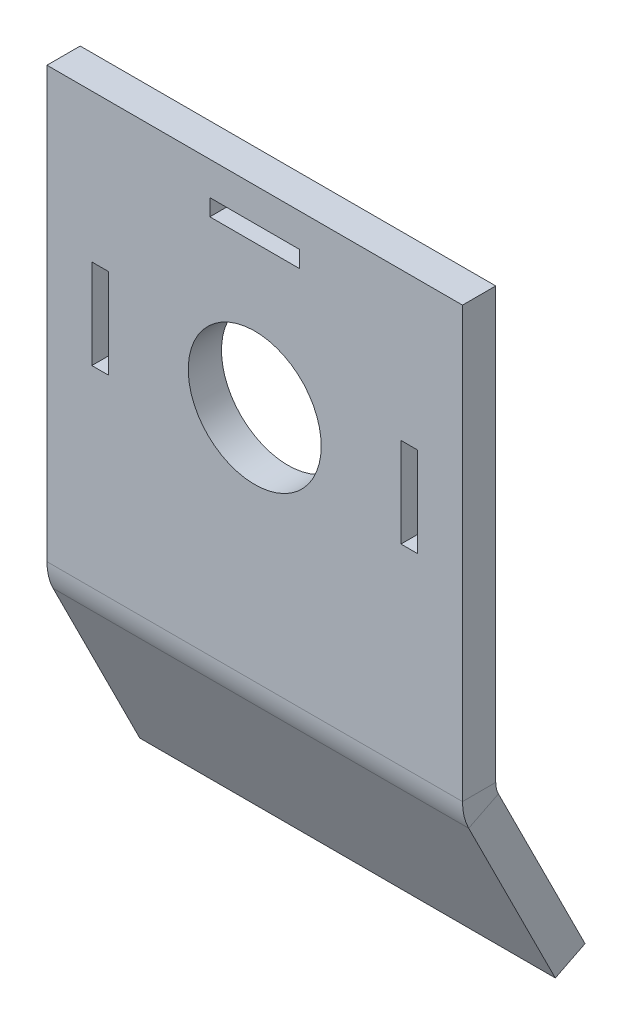
from build123d import *

# Parameters (mm, degrees)
BASES_W              = 12.5
BASES_H              = 13.35
BASE_DEPTH           = 1
SCREWACCESSS_R       = 2
SCREW_ACCESS_DEPTH   = 10.198811064
NEUTRALS_W           = 0.5
NEUTRALS_H           = 2.7
NEUTRAL_DEPTH        = 1.6
GROUNDS_W            = 2.7
GROUNDS_H            = 0.5
GROUND_DEPTH         = 1.6
EDGE_FLANGE1_START   = -6.25
EDGE_FLANGE1_DEPTH   = 12.5
EDGE_FLANGE1_2_DEPTH = 12.5


# Read off the part's stored shape, not the designer's step: Edge-Flange1
with BuildPart() as part:
    # BaseS → BASE (new body)
    with BuildSketch(Plane.XY):
        Rectangle(BASES_W, BASES_H)
    extrude(amount=-BASE_DEPTH)

    # ScrewAccessS → SCREW ACCESS (cut, through all)
    with BuildSketch(Plane.XY):
        with Locations((0, 0.875)):
            Circle(SCREWACCESSS_R)
    extrude(amount=-SCREW_ACCESS_DEPTH, mode=Mode.SUBTRACT)

    # NeutralS → NEUTRAL (cut)
    with BuildSketch(Plane.XY):
        with Locations((4.65, 0.875)):
            Rectangle(NEUTRALS_W, NEUTRALS_H)
    neutral = extrude(amount=-NEUTRAL_DEPTH, mode=Mode.SUBTRACT)

    # LINE HM: NEUTRAL across plane
    add(neutral.mirror(Plane(origin=(0, 0, 0), x_dir=(0, 0, 1), z_dir=(1, 0, 0))), mode=Mode.SUBTRACT)

    # GroundS → GROUND (cut)
    with BuildSketch(Plane.XY):
        with Locations((0, 5.425)):
            Rectangle(GROUNDS_W, GROUNDS_H)
    extrude(amount=-GROUND_DEPTH, mode=Mode.SUBTRACT)

    # Edge-Flange1 outline → Edge-Flange1 (cut)
    with BuildSketch(Plane.YZ.offset(EDGE_FLANGE1_START)):
        with BuildLine():
            Line((-6.675, 0), (-6.675, -0.049881461))
            ThreePointArc((-6.675, -0.049881461), (-6.468466602, -0.01251486), (-6.25895363, 0))
            Line((-6.25895363, 0), (-6.675, 0))
        make_face()
    extrude(amount=EDGE_FLANGE1_DEPTH, mode=Mode.SUBTRACT)

    # Edge-Flange1 2 outline → Edge-Flange1 2 (add)
    with BuildSketch(Plane.YZ.offset(EDGE_FLANGE1_START)):
        with BuildLine():
            ThreePointArc((-6.675, -0.049881461), (-6.864855726, -0.107582786), (-7.047009625, -0.186288543))
            Line((-7.047009625, -0.186288543), (-12.251294526, -2.79240029))
            Line((-12.251294526, -2.79240029), (-11.803535438, -3.686554527))
            Line((-11.803535438, -3.686554527), (-6.599250537, -1.08044278))
            ThreePointArc((-6.599250537, -1.08044278), (-6.43379143, -1.020384057), (-6.25895363, -1))
            Line((-6.25895363, -1), (-6.675, -1))
            Line((-6.675, -1), (-6.675, -0.049881461))
        make_face()
    extrude(amount=EDGE_FLANGE1_2_DEPTH)


solid = part.part
